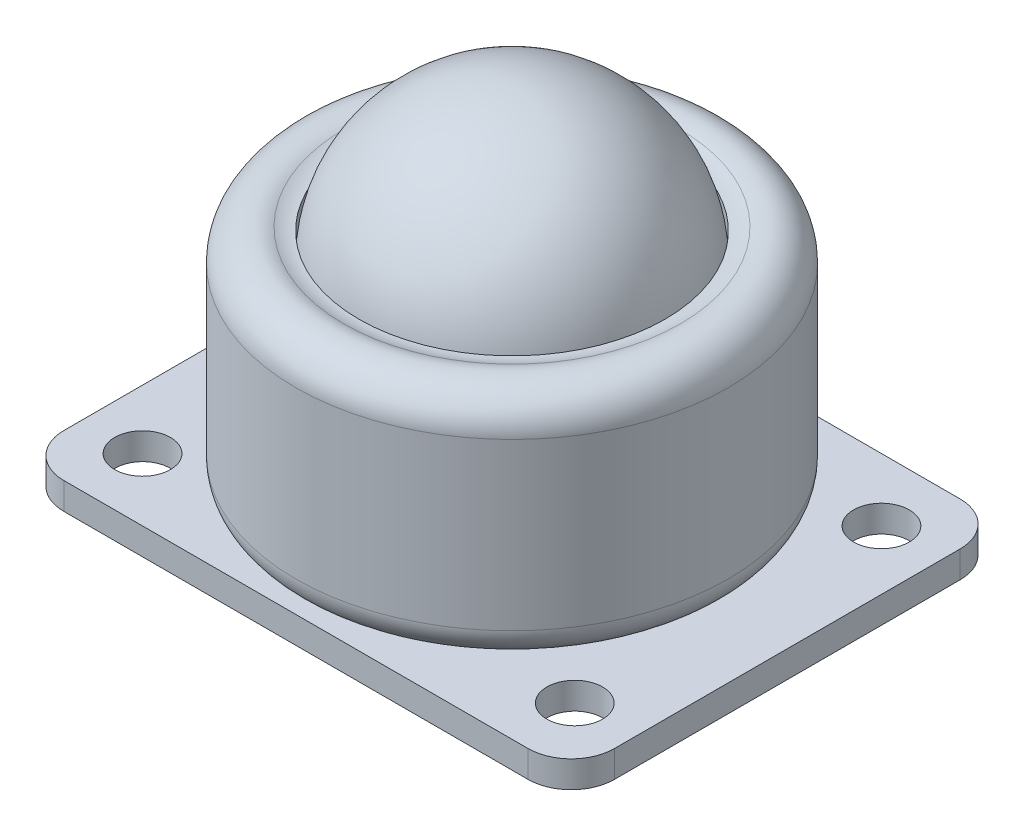
from build123d import *

# Parameters (mm, degrees)
SKETCH1_W           = 3.96875
SKETCH1_H           = 1.524
SKETCH9_R           = 8.334375
BOSS_EXTRUDE1_DEPTH = 1.524
SKETCH8_R           = 1.5875
CUT_EXTRUDE1_DEPTH  = 29.167713772
FILLET1_R           = 2.54
CHAMFER1_SIZE       = 1.984375


# Read off the part's stored shape, not the designer's step: Move Face1
with BuildPart() as part:
    # Sketch4 → Revolve3 (revolve)
    with BuildSketch(Plane.XY, mode=Mode.PRIVATE) as revolve3_sk:
        with BuildLine():
            Line((8.334375, 1.524), (10.556875, 1.524))
            ThreePointArc((10.556875, 1.524), (11.791660217, 2.035464783), (12.303125, 3.27025))
            Line((12.303125, 3.27025), (12.303125, 12.7))
            ThreePointArc((12.303125, 12.7), (11.245959863, 14.433593317), (9.220718975, 14.2875))
            Line((9.220718975, 14.2875), (0, 14.2875))
            Line((0, 14.2875), (0, -3.96875))
            Line((0, -3.96875), (8.334375, -3.96875))
            Line((8.334375, -3.96875), (8.334375, 1.524))
        make_face()
    revolve(revolve3_sk.sketch.rotate(Axis((0, 14.2875, 0), (0, -1, 0)), 90), axis=Axis((0, 14.2875, 0), (0, -1, 0)))

    # Sketch3<2> → Cut-Revolve1 (revolve, cut)
    with BuildSketch(Plane.XY):
        with BuildLine():
            Line((0, 21.43125), (0, 3.96875))
            ThreePointArc((0, 3.96875), (8.73125, 12.7), (0, 21.43125))
        make_face()
    revolve(axis=Axis((0, 21.43125, 0), (0, -1, 0)), mode=Mode.SUBTRACT)

    # Move Face1 outline → Move Face1 (revolve, cut)
    with BuildSketch(Plane.XY):
        with BuildLine():
            Line((0, 3.96875), (0, 3.84175))
            ThreePointArc((0, 3.84175), (6.801877131, 7.025225947), (8.714840032, 14.287500009))
            Line((8.714840032, 14.287500009), (8.585718973, 14.287500009))
            ThreePointArc((8.585718973, 14.287500009), (6.711765268, 7.115473739), (0, 3.96875))
        make_face()
    revolve(axis=Axis((0, 0, 0), (0, 1, 0)), mode=Mode.SUBTRACT)

    # Fillet1
    # the kernel refuses this fillet: 2.54 mm, written as the material it adds along each edge
    with BuildSketch(Plane(origin=(0, 14.2875, 0), x_dir=(0, 0, 1), z_dir=(1, 0, 0))) as fillet1_piece_1:
        with BuildLine():
            CenterArc((8.576965685, -2.536255253), FILLET1_R, 66.69777577, 20.19060902)
            Line((8.714840032, -9e-09), (9.220718975, 0))
            ThreePointArc((9.220718975, 0), (9.395810874, -0.111337644), (9.581741823, -0.203440449))
        make_face()
    revolve(axis=Axis((0, 14.2875, 0), (0, -1, 0)))

    # Chamfer1
    chamfer1_edges = [part.edges().sort_by_distance(p)[0] for p in [
        (0, -3.96875, -8.334375),
    ]]
    chamfer(chamfer1_edges, length=CHAMFER1_SIZE)


with BuildPart() as body_2:
    # Sketch1 → Revolve1 (revolve)
    with BuildSketch(Plane.XY, mode=Mode.PRIVATE) as revolve1_sk:
        with Locations((10.31875, 0.762)):
            Rectangle(SKETCH1_W, SKETCH1_H)
    revolve(revolve1_sk.sketch.rotate(Axis((0, 14.2875, 0), (0, -1, 0)), 90), axis=Axis((0, 14.2875, 0), (0, -1, 0)))

    # Sketch9 → Boss-Extrude1 (add)
    with BuildSketch(Plane(origin=(0, 1.524, 0), x_dir=(1, 0, 0), z_dir=(0, 1, 0))):
        with BuildLine():
            Line((-13.2159375, 12.303125), (13.2159375, 12.303125))
            ThreePointArc((13.2159375, 12.303125), (14.955862123, 11.582424623), (15.6765625, 9.8425))
            Line((15.6765625, 9.8425), (15.6765625, -9.8425))
            ThreePointArc((15.6765625, -9.8425), (14.955862123, -11.582424623), (13.2159375, -12.303125))
            Line((13.2159375, -12.303125), (-13.2159375, -12.303125))
            ThreePointArc((-13.2159375, -12.303125), (-14.955862123, -11.582424623), (-15.6765625, -9.8425))
            Line((-15.6765625, -9.8425), (-15.6765625, 9.8425))
            ThreePointArc((-15.6765625, 9.8425), (-14.955862123, 11.582424623), (-13.2159375, 12.303125))
        make_face()
        with Locations(Location((0, 0, 0), (0, 0, 270))):
            Circle(SKETCH9_R, mode=Mode.SUBTRACT)
    extrude(amount=-BOSS_EXTRUDE1_DEPTH)

    # Sketch8 → Cut-Extrude1 (cut, through all)
    with BuildSketch(Plane(origin=(0, 1.524, 0), x_dir=(1, 0, 0), z_dir=(0, 1, 0))):
        with Locations(Location((-12.303125, 8.73125, 0), (0, 0, 180))):
            Circle(SKETCH8_R)
        with Locations(Location((12.303125, -8.73125, 0), (0, 0, 180))):
            Circle(SKETCH8_R)
        with Locations(Location((12.303125, 8.73125, 0), (0, 0, 180))):
            Circle(SKETCH8_R)
        with Locations(Location((-12.303125, -8.73125, 0), (0, 0, 180))):
            Circle(SKETCH8_R)
    extrude(amount=-CUT_EXTRUDE1_DEPTH, mode=Mode.SUBTRACT)


with BuildPart() as body_3:
    # Sketch3 → Revolve2 (revolve)
    with BuildSketch(Plane.XY):
        with BuildLine():
            Line((0, 21.43125), (0, 3.96875))
            ThreePointArc((0, 3.96875), (8.73125, 12.7), (0, 21.43125))
        make_face()
    revolve(axis=Axis((0, 21.43125, 0), (0, -1, 0)))


solid = Compound([part.part, body_2.part, body_3.part])
